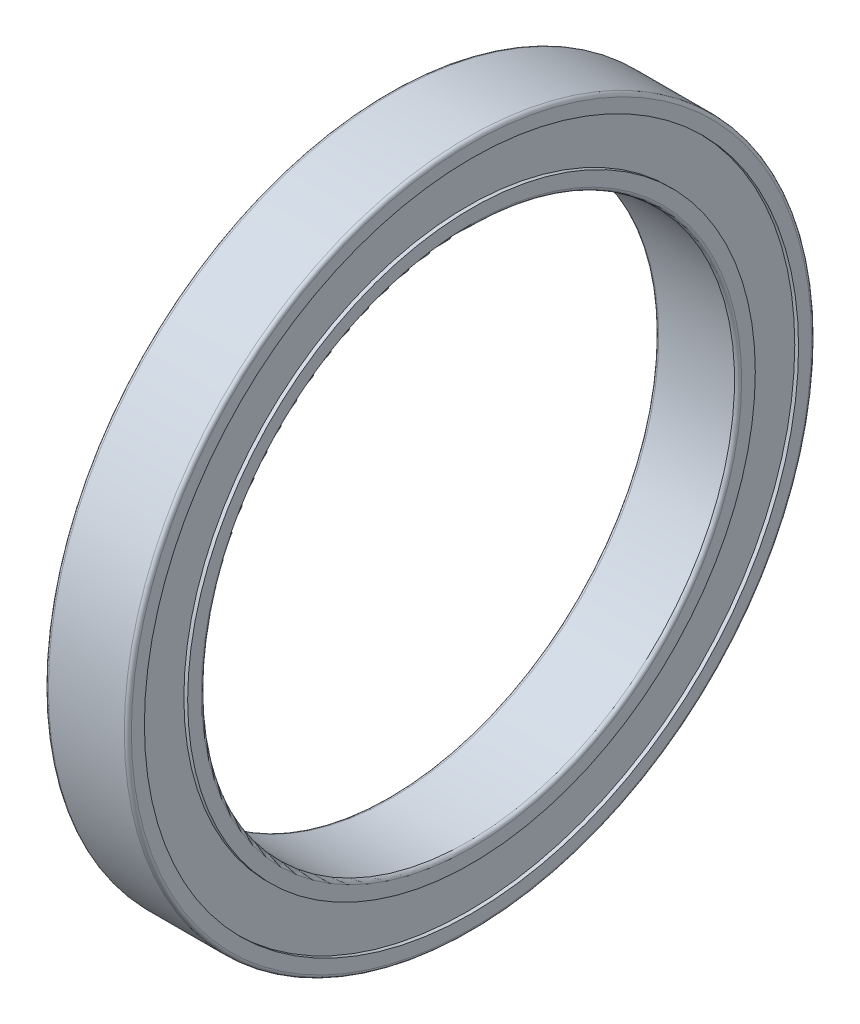
from build123d import *

# Parameters (mm, degrees)
FILLET1_R = 0.3
FILLET2_R = 0.3


with BuildPart() as part:
    # Sketch1 → Revolve1 (revolve)
    with BuildSketch(Plane.XY):
        Polygon((0, 22.5), (7, 22.5), (7, 23.95), (6.68, 23.95), (6.68, 27.6), (7, 27.6), (7, 29), (0, 29), (0, 27.6), (0.32, 27.6), (0.32, 23.95), (0, 23.95), align=None)
    revolve(axis=Axis((0, 0, 0), (1, 0, 0)))

    # Fillet1
    fillet1_edges = [part.edges().sort_by_distance(p)[0] for p in [
        (7, -29, 0),
        (0, -29, 0),
    ]]
    fillet(fillet1_edges, radius=FILLET1_R)

    # Fillet2
    fillet2_edges = [part.edges().sort_by_distance(p)[0] for p in [
        (7, -22.5, 0),
        (0, -22.5, 0),
    ]]
    fillet(fillet2_edges, radius=FILLET2_R)


solid = part.part
